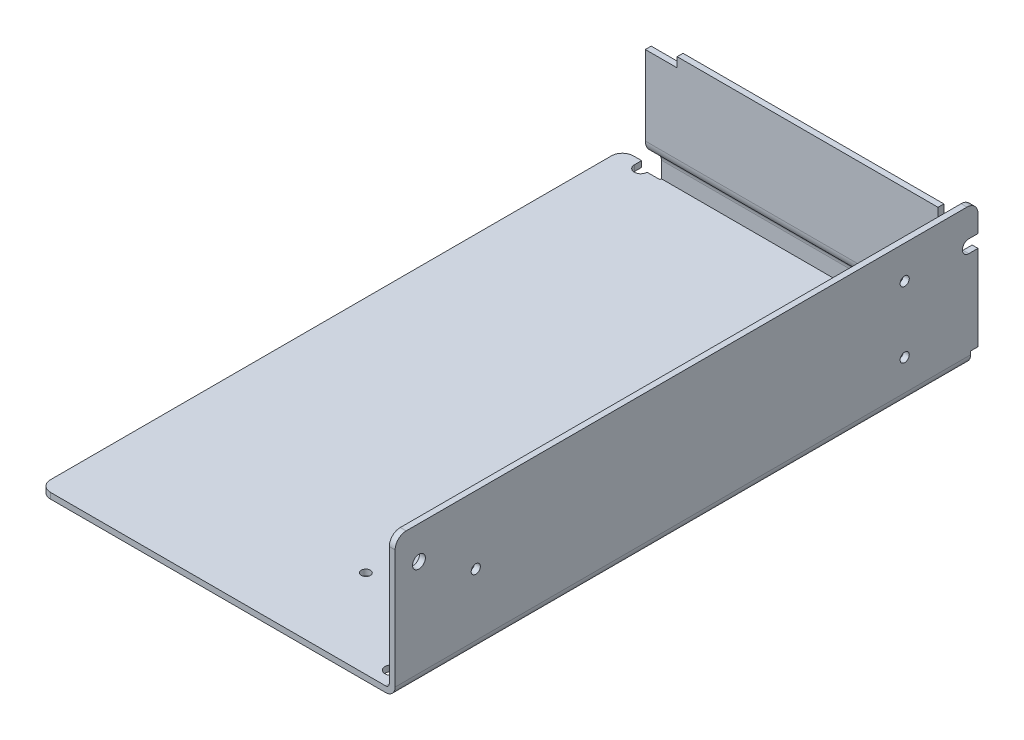
from build123d import *

# Parameters (mm, degrees)
EXTRUDE_THIN1_DEPTH        = 79.5
FILLET1_R                  = 3
EXTRUDE1_DEPTH             = 101.58081328
SKETCH4_W                  = 88.25
SKETCH4_H                  = 2
EXTRUDE2_DEPTH             = 3.5
EXTRUDE_THIN2_START        = -82
EXTRUDE_THIN2_DEPTH        = 82
FILLET2_R                  = 2
SKETCH6_W                  = 2.155687989
SKETCH6_H                  = 5.613141175
SKETCH6_W_2                = 8.683222246
SKETCH6_H_2                = 2.647575272
EXTRUDE3_DEPTH             = 167.425388688
F_3_5_3_5_DIAMETER_HOLE1_D = 3.5
SKETCH9_R                  = 1.75
EXTRUDE4_DEPTH             = 132.046747384
M3_TAPPED_HOLE1_D          = 2.5
M3_TAPPED_HOLE2_D          = 2.5


# Read off the part's stored shape, not the designer's step: Extrude-Thin2
with BuildPart() as part:
    # Sketch1 → Extrude-Thin1 (new, symmetric)
    with BuildSketch(Plane.XY):
        with BuildLine():
            Line((-48.5, 0), (45.9, 0))
            ThreePointArc((45.9, 0), (47.738477631, 0.761522369), (48.5, 2.6))
            Line((48.5, 2.6), (48.5, 38))
            Line((48.5, 38), (46.9, 38))
            Line((46.9, 38), (46.9, 2.6))
            ThreePointArc((46.9, 2.6), (46.607106781, 1.892893219), (45.9, 1.6))
            Line((45.9, 1.6), (-48.5, 1.6))
            Line((-48.5, 1.6), (-48.5, 0))
        make_face()
    extrude(amount=EXTRUDE_THIN1_DEPTH, both=True)

    # Fillet1
    fillet1_edges = [part.edges().sort_by_distance(p)[0] for p in [
        (-48.5, 0.8, 79.5),
        (47.7, 38, 79.5),
        (-48.5, 0.8, -79.5),
        (47.7, 38, -79.5),
    ]]
    fillet(fillet1_edges, radius=FILLET1_R)

    # Sketch3 → Extrude1 (cut, through all)
    with BuildSketch(Plane.XZ):
        with BuildLine():
            Line((-43.25, -81.5), (-43.25, -77.5))
            ThreePointArc((-43.25, -77.5), (-41.5, -75.75), (-39.75, -77.5))
            Line((-39.75, -77.5), (-39.75, -81.5))
            ThreePointArc((-39.75, -81.5), (-41.5, -83.25), (-43.25, -81.5))
        make_face()
    extrude(amount=-EXTRUDE1_DEPTH, mode=Mode.SUBTRACT)

    # Sketch4 → Extrude2 (cut)
    with BuildSketch(Plane.XZ):
        with Locations((4.375, -78.5)):
            Rectangle(SKETCH4_W, SKETCH4_H)
    extrude(amount=-EXTRUDE2_DEPTH, mode=Mode.SUBTRACT)

    # Extrude-Thin2 outline → Extrude-Thin2 (add)
    with BuildSketch(Plane(origin=(45.75, 0, 0), x_dir=(0, 0, -1), z_dir=(1, 0, 0)).offset(EXTRUDE_THIN2_START)):
        with BuildLine():
            Line((77.5, 0), (79.5, 0))
            Line((79.5, 0), (79.5, 6.008831175))
            ThreePointArc((79.5, 6.008831175), (79.225966317, 7.386491532), (78.445584412, 8.554415588))
            Line((78.445584412, 8.554415588), (75.685786438, 11.314213562))
            ThreePointArc((75.685786438, 11.314213562), (75.252240935, 11.96306026), (75.1, 12.728427125))
            Line((75.1, 12.728427125), (75.1, 37))
            Line((75.1, 37), (73.5, 37))
            Line((73.5, 37), (73.5, 12.728427125))
            ThreePointArc((73.5, 12.728427125), (73.774033683, 11.350766768), (74.554415588, 10.182842712))
            Line((74.554415588, 10.182842712), (77.314213562, 7.423044738))
            ThreePointArc((77.314213562, 7.423044738), (77.747759065, 6.77419804), (77.9, 6.008831175))
            Line((77.9, 6.008831175), (77.9, 1.6))
            Line((77.9, 1.6), (77.5, 1.6))
            Line((77.5, 1.6), (77.5, 0))
        make_face()
    extrude(amount=EXTRUDE_THIN2_DEPTH)

    # Fillet2
    fillet2_edges = [part.edges().sort_by_distance(p)[0] for p in [
        (4.75, 0, -79.5),
    ]]
    fillet(fillet2_edges, radius=FILLET2_R)

    # Sketch6 → Extrude3 (cut, through all)
    with BuildSketch(Plane(origin=(0, 0, -75.1), x_dir=(-1, 0, 0), z_dir=(0, 0, -1))):
        with Locations((-44.672156005, 34.193429413)):
            Rectangle(SKETCH6_W, SKETCH6_H)
        with Locations((31.908388877, 35.676212364)):
            Rectangle(SKETCH6_W_2, SKETCH6_H_2)
    extrude(amount=-EXTRUDE3_DEPTH, mode=Mode.SUBTRACT)

    # Ø3.5 (3.5) Diameter Hole1 (through all)
    with Locations(Plane(origin=(0, 1.6, 0), x_dir=(-1, 0, 0), z_dir=(0, 1, 0))):
        with Locations((-43, 75)):
            Hole(F_3_5_3_5_DIAMETER_HOLE1_D / 2)

    # Sketch9 → Extrude4 (cut, through all)
    with BuildSketch(Plane(origin=(48.5, 0, 0), x_dir=(0, 0, -1), z_dir=(1, 0, 0))):
        with Locations((-73, 29)):
            Circle(SKETCH9_R)
        with BuildLine():
            Line((82, 26.75), (77, 26.75))
            ThreePointArc((77, 26.75), (75.25, 28.5), (77, 30.25))
            Line((77, 30.25), (82, 30.25))
            ThreePointArc((82, 30.25), (83.75, 28.5), (82, 26.75))
        make_face()
    extrude(amount=-EXTRUDE4_DEPTH, mode=Mode.SUBTRACT)

    # M3 Tapped Hole1 (through all)
    with Locations(Plane(origin=(48.5, 0, 0), x_dir=(0, 0, -1), z_dir=(1, 0, 0))):
        with Locations((-57.5, 19.5), (59.5, 29), (59.5, 11)):
            Hole(M3_TAPPED_HOLE1_D / 2)

    # M3 Tapped Hole2 (through all)
    with Locations(Plane.XZ):
        with Locations((16.5, 55.5), (16.5, -22.5)):
            Hole(M3_TAPPED_HOLE2_D / 2)


solid = part.part
